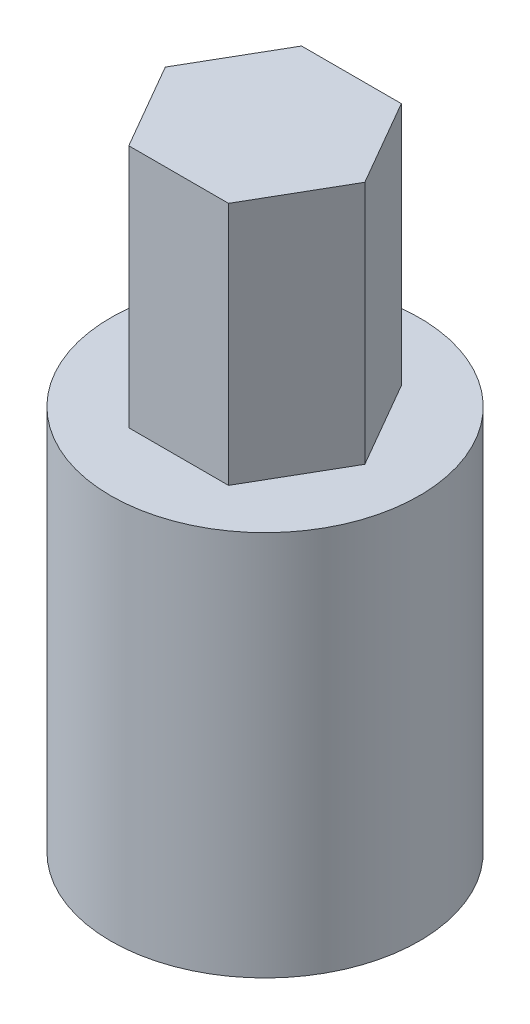
from build123d import *

# Parameters (mm, degrees)
SKETCH1_R           = 6
BOSS_EXTRUDE1_DEPTH = 15
BOSS_EXTRUDE2_DEPTH = 9.5
CUT_EXTRUDE1_DEPTH  = 12


with BuildPart() as part:
    # Sketch1 → Boss-Extrude1 (new body)
    with BuildSketch(Plane(origin=(0, 0, 0), x_dir=(1, 0, 0), z_dir=(0, 1, 0))):
        Circle(SKETCH1_R)
    extrude(amount=BOSS_EXTRUDE1_DEPTH)

    # Sketch4 → Boss-Extrude2 (add)
    with BuildSketch(Plane(origin=(0, 15, 0), x_dir=(1, 0, 0), z_dir=(0, 1, 0))):
        Polygon((1.939896904, 3.36), (-1.939896904, 3.36), (-3.879793809, 0), (-1.939896904, -3.36), (1.939896904, -3.36), (3.879793809, 0), align=None)
    extrude(amount=BOSS_EXTRUDE2_DEPTH)

    # Sketch5 → Cut-Extrude1 (cut)
    with BuildSketch(Plane.XZ):
        with BuildLine():
            Line((1.641066726, 2.63), (-1.641066726, 2.63))
            ThreePointArc((-1.641066726, 2.63), (-1.503777435, -2.710839985), (3.1, 0))
            ThreePointArc((3.1, 0), (2.710839985, 1.503777435), (1.641066726, 2.63))
        make_face()
    extrude(amount=-CUT_EXTRUDE1_DEPTH, mode=Mode.SUBTRACT)


solid = part.part
